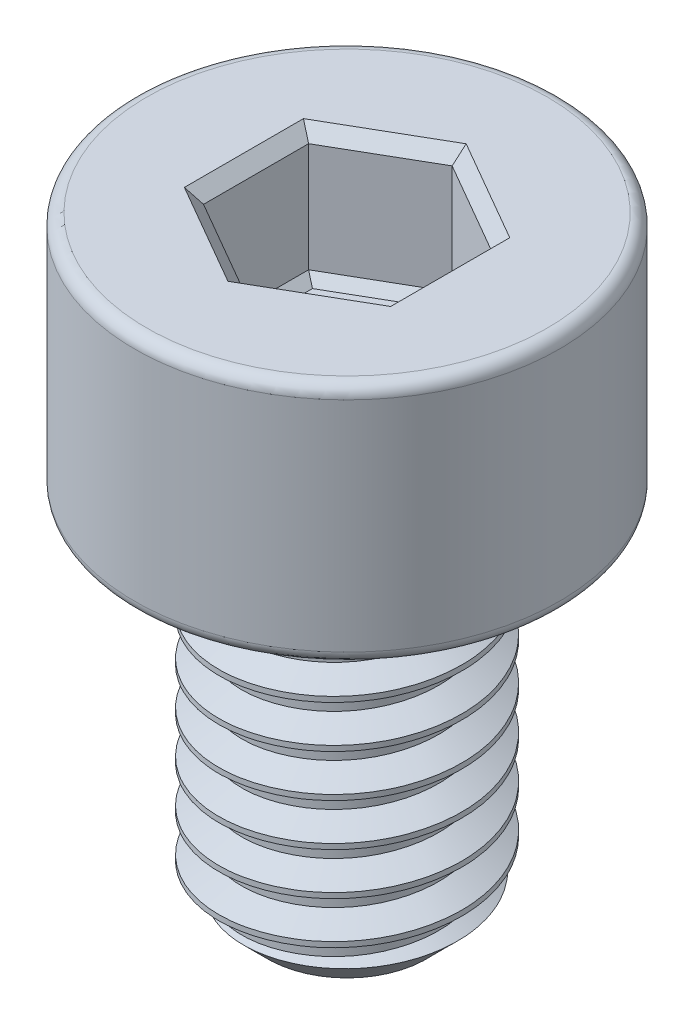
from build123d import *

# Parameters (mm, degrees)
SKETCH1_R           = 2
BOSS_EXTRUDE1_DEPTH = 6
THREAD1_PITCH       = 0.7
SKETCH4_R           = 3.5
BOSS_EXTRUDE2_DEPTH = 4
FILLET1_R           = 0.2
CUT_EXTRUDE1_DEPTH  = 2
CHAMFER1_SIZE       = 0.2
CUT_EXTRUDE2_DEPTH  = 0.15
CUT_EXTRUDE2_DRAFT  = -45


with BuildPart() as part:
    # Sketch1 → Boss-Extrude1 (new body)
    with BuildSketch(Plane(origin=(0, 0, 0), x_dir=(1, 0, 0), z_dir=(0, 1, 0))):
        with Locations(Location((0, 0, 0), (0, 0, 270))):
            Circle(SKETCH1_R)
    extrude(amount=BOSS_EXTRUDE1_DEPTH)

    # Thread1: the profile of Thread Profile1 profile screwed along a right-hand helix of 10 turns, 6 arcs to a turn; built about Z, then put on its axis
    thread1_z = Axis((0, 0, 0), (0, 0, 1))
    thread1_corners = [(2.0003, 0, -0.000173205), (2.0003, 0, 0.612673203), (1.621113887, 0, 0.393749999), (1.621113887, 0, 0.218749999)]
    with BuildLine(mode=Mode.PRIVATE) as thread1_profile:
        Line(thread1_corners[0], thread1_corners[1])
        Line(thread1_corners[1], thread1_corners[2])
        Line(thread1_corners[2], thread1_corners[3])
        Line(thread1_corners[3], thread1_corners[0])
    thread1_cap = Face(thread1_profile.wire())
    thread1_turn_angles = [0, 30, 60, 90, 120, 150, 180, 210, 240, 270, 300, 330, 360]
    thread1_turn_weights = [1, 0.8660254037844387, 1, 0.8660254037844387, 1, 0.8660254037844387, 1, 0.8660254037844387, 1, 0.8660254037844387, 1, 0.8660254037844387, 1]
    thread1_turn_rails = [Edge.make_bspline([Vector(p[0], p[1], 0).rotate(thread1_z, thread1_turn_angles[k]) / thread1_turn_weights[k] + Vector(0, 0, p[2] + THREAD1_PITCH * thread1_turn_angles[k] / 360) for k in range(13)], [0, 0, 0, 1, 1, 2, 2, 3, 3, 4, 4, 5, 5, 6, 6, 6], 2, thread1_turn_weights) for p in thread1_corners]
    thread1_turn_sides = [Face.make_surface_from_curves(thread1_turn_rails[p[0]], thread1_turn_rails[p[1]]) for p in [(0, 1), (1, 2), (2, 3), (3, 0)]]
    thread1 = Plane(origin=(0, -1, 0), x_dir=(1, 0, 0), z_dir=(0, 1, 0)) * Solid(Shell([*[p.moved(Location((0, 0, THREAD1_PITCH * i))) for i in range(10) for p in thread1_turn_sides], thread1_cap, thread1_cap.rotate(thread1_z, 3600).moved(Location((0, 0, THREAD1_PITCH * 3600 / 360)))]))
    add(thread1, mode=Mode.SUBTRACT)

    # Sketch4 → Boss-Extrude2 (add)
    with BuildSketch(Plane(origin=(0, 6, 0), x_dir=(-1, 0, 0), z_dir=(0, -1, 0))):
        with Locations(Location((0, 0, 0), (0, 0, 90))):
            Circle(SKETCH4_R)
    extrude(amount=-BOSS_EXTRUDE2_DEPTH)

    # Fillet1
    fillet1_edges = [part.edges().sort_by_distance(p)[0] for p in [
        (0, 6, 3.5),
        (0, 10, 3.5),
    ]]
    fillet(fillet1_edges, radius=FILLET1_R)

    # Sketch6 → Cut-Revolve1 (revolve, cut)
    with BuildSketch(Plane.XY, mode=Mode.PRIVATE) as cut_revolve1_sk:
        Polygon((2.01, 0), (2.01, 0.7), (1.31, 0), align=None)
    revolve(cut_revolve1_sk.sketch.rotate(Axis((0, 0, 0), (0, 1, 0)), 202.132599438), axis=Axis((0, 0, 0), (0, 1, 0)), mode=Mode.SUBTRACT)

    # Sketch7 → Cut-Extrude1 (cut)
    with BuildSketch(Plane(origin=(0, 10, 0), x_dir=(1, 0, 0), z_dir=(0, 1, 0))):
        Polygon((0, 1.732050808), (-1.5, 0.866025404), (-1.5, -0.866025404), (0, -1.732050808), (1.5, -0.866025404), (1.5, 0.866025404), align=None)
    extrude(amount=-CUT_EXTRUDE1_DEPTH, mode=Mode.SUBTRACT)

    # Chamfer1
    chamfer1_edges = [part.edges().sort_by_distance(p)[0] for p in [
        (0.75, 10, -1.299038106),
        (-0.75, 10, -1.299038106),
        (-1.5, 10, 0),
        (-0.75, 10, 1.299038106),
        (0.75, 10, 1.299038106),
        (1.5, 10, 0),
    ]]
    chamfer(chamfer1_edges, length=CHAMFER1_SIZE)


with BuildPart() as cut_extrude2_tool:
    # Sketch8 → Cut-Extrude2 (with draft: the straight prism first)
    with BuildSketch(Plane(origin=(0, 8, 0), x_dir=(1, 0, 0), z_dir=(0, 1, 0))):
        Polygon((0, 1.732050808), (-1.5, 0.866025404), (-1.5, -0.866025404), (0, -1.732050808), (1.5, -0.866025404), (1.5, 0.866025404), align=None)
    extrude(amount=-CUT_EXTRUDE2_DEPTH)
    # Cut-Extrude2: the draft: its side faces are tilted about the plane it starts from
    cut_extrude2_sides = [cut_extrude2_tool.faces().sort_by_distance(p)[0] for p in [
        (-0.75, 7.925, -1.299038106),
        (-1.5, 7.925, 0),
        (-0.75, 7.925, 1.299038106),
        (0.75, 7.925, 1.299038106),
        (1.5, 7.925, 0),
        (0.75, 7.925, -1.299038106),
    ]]
    draft(cut_extrude2_sides, Plane(origin=(0, 8, 0), x_dir=(1, 0, 0), z_dir=(0, 1, 0)), CUT_EXTRUDE2_DRAFT)


with BuildPart() as part_1:
    add(part.part)

    # Cut-Extrude2: cut by cut_extrude2_tool
    add(cut_extrude2_tool.part, mode=Mode.SUBTRACT)


solid = part_1.part
